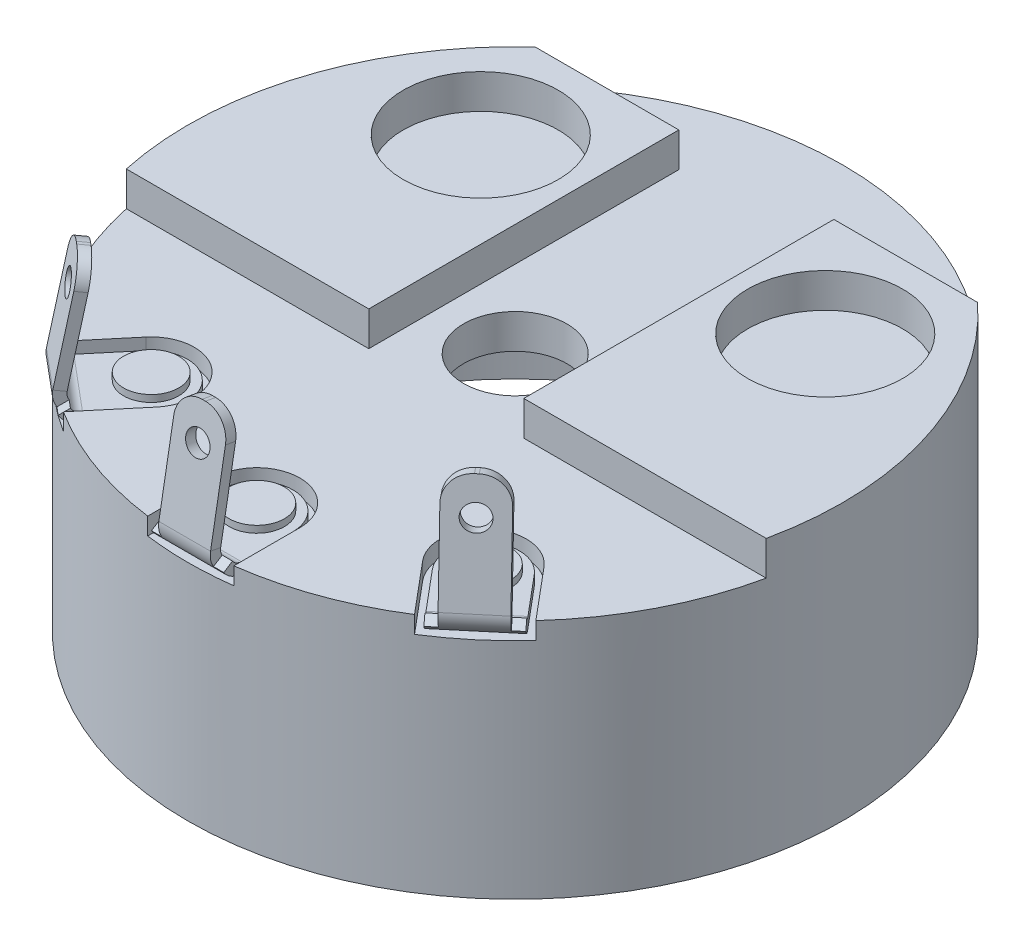
from build123d import *
from build123d.topology import SkipClean

# Parameters (mm, degrees)
SKETCH1_R                  = 4.75
SKETCH1_R_2                = 0.75
BOSS_EXTRUDE1_DEPTH        = 0.5
BOSS_EXTRUDE2_START        = 0.5
SKETCH1_3_R                = 1.125
BOSS_EXTRUDE2_DEPTH        = 0.5
SKETCH3_R                  = 0.375
CUT_EXTRUDE1_DEPTH         = 0.5
SKETCH3_3_R                = 0.375
CUT_EXTRUDE2_DEPTH         = 0.25
CIRPATTERN1_COUNT          = 3
CIRPATTERN1_ANGLE          = 80
EXTRUDE_THIN1_START        = -0.5
SKETCH1_4_R                = 4.75
SKETCH1_4_R_2              = 4.5
EXTRUDE_THIN1_DEPTH        = 3
BASE_FLANGE1_START         = 0.15
SKETCH4_R                  = 0.175
SKETCH4_R_2                = 0.375
BASE_FLANGE1_DEPTH         = 0.15
SKETCHED_START             = -0.525
SKETCHED_BEND1_DEPTH       = 1.05
SKETCHED_BEND1_2_DEPTH     = 1.05
SKETCHED_START_2           = -0.375
SKETCHED_BEND1_3_DEPTH     = 0.75
SKETCHED_START_3           = -4.741475404
SKETCHED_BEND1_4_OUTLINE_R = 0.175
SKETCHED_BEND1_4_DEPTH     = 0.149999999
SKETCH10_R                 = 0.375
BASE_FLANGE2_DEPTH         = 0.15
CIRPATTERN2_COUNT          = 3
CIRPATTERN2_ANGLE          = 80


with BuildPart() as part:
    # Sketch1 → Boss-Extrude1 (new body)
    with BuildSketch(Plane(origin=(0, 0, 0), x_dir=(1, 0, 0), z_dir=(0, 1, 0))):
        with Locations(Location((0, 0, 0), (0, 0, 270))):
            Circle(SKETCH1_R)
        with Locations(Location((0, 0, 0), (0, 0, 270))):
            Circle(SKETCH1_R_2, mode=Mode.SUBTRACT)
    extrude(amount=-BOSS_EXTRUDE1_DEPTH)

    # Sketch1<3> → Boss-Extrude2 (add)
    # profile 1 of 2: a face of its own
    with BuildSketch(Plane(origin=(0, 0, 0), x_dir=(1, 0, 0), z_dir=(0, 1, 0)).offset(BOSS_EXTRUDE2_START)):
        with BuildLine():
            ThreePointArc((-3.211308145, 3.5), (-4.526276083, 1.440598771), (-4.643543905, -1))
            Line((-4.643543905, -1), (-1.125, -1))
            Line((-1.125, -1), (-1.125, 3.5))
            Line((-1.125, 3.5), (-3.211308145, 3.5))
        make_face()
        with Locations(Location((-2.5, 2, 0), (0, 0, 270))):
            Circle(SKETCH1_3_R, mode=Mode.SUBTRACT)
    # profile 2 of 2: a face of its own
    with BuildSketch(Plane(origin=(0, 0, 0), x_dir=(1, 0, 0), z_dir=(0, 1, 0)).offset(BOSS_EXTRUDE2_START)):
        with BuildLine():
            Line((1.125, -1), (4.643543905, -1))
            ThreePointArc((4.643543905, -1), (4.723310997, -0.502825243), (4.75, 0))
            ThreePointArc((4.75, 0), (4.348345299, 1.911646713), (3.211308145, 3.5))
            Line((3.211308145, 3.5), (1.125, 3.5))
            Line((1.125, 3.5), (1.125, -1))
        make_face()
        with Locations(Location((2.5, 2, 0), (0, 0, 270))):
            Circle(SKETCH1_3_R, mode=Mode.SUBTRACT)
    extrude(amount=-BOSS_EXTRUDE2_DEPTH)

    # Sketch3 → Cut-Extrude1 (cut)
    with BuildSketch(Plane(origin=(0, 0, 0), x_dir=(1, 0, 0), z_dir=(0, 1, 0))):
        with Locations(Location((-2.410453536, -2.872666662, 0), (0, 0, 270))):
            Circle(SKETCH3_R)
    cut_extrude1 = extrude(amount=-CUT_EXTRUDE1_DEPTH, mode=Mode.SUBTRACT)

    # Sketch3<3> → Cut-Extrude2 (cut)
    with BuildSketch(Plane(origin=(0, 0, 0), x_dir=(1, 0, 0), z_dir=(0, 1, 0))):
        with BuildLine():
            Line((-3.505473113, -3.205332784), (-2.889231313, -2.470924406))
            ThreePointArc((-2.889231313, -2.470924406), (-2.00871128, -2.393888885), (-1.931675759, -3.274408918))
            Line((-1.931675759, -3.274408918), (-2.547917559, -4.008817296))
            ThreePointArc((-2.547917559, -4.008817296), (-3.053241146, -3.638711105), (-3.505473113, -3.205332784))
        make_face()
        with Locations(Location((-2.410453536, -2.872666662, 0), (0, 0, 270))):
            Circle(SKETCH3_3_R, mode=Mode.SUBTRACT)
    cut_extrude2 = extrude(amount=-CUT_EXTRUDE2_DEPTH, mode=Mode.SUBTRACT)

    # CirPattern1: Cut-Extrude1, Cut-Extrude2 ×3 about axis
    cirpattern1_axis = Axis((0, 0, 0), (0, 1, 0))
    add([cut_extrude1.rotate(cirpattern1_axis, i * CIRPATTERN1_ANGLE / (CIRPATTERN1_COUNT - 1)) for i in range(1, CIRPATTERN1_COUNT)], mode=Mode.SUBTRACT)
    add([cut_extrude2.rotate(cirpattern1_axis, i * CIRPATTERN1_ANGLE / (CIRPATTERN1_COUNT - 1)) for i in range(1, CIRPATTERN1_COUNT)], mode=Mode.SUBTRACT)

    # Sketch1<4> → Extrude-Thin1 (add)
    with BuildSketch(Plane(origin=(0, 0, 0), x_dir=(1, 0, 0), z_dir=(0, 1, 0)).offset(EXTRUDE_THIN1_START)):
        Circle(SKETCH1_4_R)
        Circle(SKETCH1_4_R_2, mode=Mode.SUBTRACT)
    extrude(amount=-EXTRUDE_THIN1_DEPTH)


with BuildPart() as body_2:
    # Base-Flange1: sheet metal written as solids
    # Sketch4 → Base-Flange1 (new body)
    with BuildSketch(Plane(origin=(0, -0.25, 0), x_dir=(1, 0, 0), z_dir=(0, 1, 0)).offset(BASE_FLANGE1_START)):
        with BuildLine():
            Line((-2.812626869, -2.535203167), (-3.428868668, -3.269611545))
            Line((-3.428868668, -3.269611545), (-3.313962002, -3.366029686))
            Line((-3.313962002, -3.366029686), (-4.213864655, -4.438491907))
            ThreePointArc((-4.213864655, -4.438491907), (-4.294417245, -4.69397208), (-4.170724764, -4.931583125))
            Line((-4.170724764, -4.931583125), (-4.132422542, -4.963722506))
            ThreePointArc((-4.132422542, -4.963722506), (-3.876942368, -5.044275095), (-3.639331323, -4.920582614))
            Line((-3.639331323, -4.920582614), (-2.73942867, -3.848120394))
            Line((-2.73942867, -3.848120394), (-2.624522003, -3.944538535))
            Line((-2.624522003, -3.944538535), (-2.008280204, -3.210130157))
            ThreePointArc((-2.008280204, -3.210130157), (-2.072990041, -2.470493329), (-2.812626869, -2.535203167))
        make_face()
        with Locations(Location((-3.830179848, -4.564630594, 0), (0, 0, 270))):
            Circle(SKETCH4_R, mode=Mode.SUBTRACT)
        with Locations(Location((-2.410453536, -2.872666662, 0), (0, 0, 270))):
            Circle(SKETCH4_R_2, mode=Mode.SUBTRACT)
    extrude(amount=-BASE_FLANGE1_DEPTH)

    # Sketched Bend1: read off the stored shape, not the designer's step
    # Sketched Bend1 outline → Sketched Bend1 (cut)
    with BuildSketch(Plane(origin=(0, 0, 0), x_dir=(0.6427876096865488, 0, -0.7660444431189701), z_dir=(0.76604444311897, 0, 0.642787609686549)).offset(SKETCHED_START)):
        with BuildLine():
            Line((-4.760983594, -0.1), (-6.45870205, -0.1))
            Line((-6.45870205, -0.1), (-6.45870205, -0.25))
            Line((-6.45870205, -0.25), (-4.501175973, -0.25))
            ThreePointArc((-4.501175973, -0.25), (-4.651175973, -0.209807621), (-4.760983594, -0.1))
        make_face()
    extrude(amount=SKETCHED_BEND1_DEPTH, mode=Mode.SUBTRACT)

    # Sketched Bend1 2 outline → Sketched Bend1 2 (add)
    with SkipClean():  # the faces are left unmerged after this step: merging them gives an invalid solid
        with BuildSketch(Plane(origin=(0, 0, 0), x_dir=(0.6427876096865488, 0, -0.7660444431189701), z_dir=(0.76604444311897, 0, 0.642787609686549)).offset(SKETCHED_START)):
            with BuildLine():
                ThreePointArc((-4.501175973, -0.1), (-4.57325702, -0.081545895), (-4.627602184, -0.030724302))
                Line((-4.627602184, -0.030724302), (-4.754028396, -0.111448605))
                ThreePointArc((-4.754028396, -0.111448605), (-4.73301345, -0.140397963), (-4.70870205, -0.166640087))
                Line((-4.70870205, -0.166640087), (-4.70870205, -0.1))
                Line((-4.70870205, -0.1), (-4.501175973, -0.1))
            make_face()
        extrude(amount=SKETCHED_BEND1_2_DEPTH)

    # Sketched Bend1 3 outline → Sketched Bend1 3 (add)
    with SkipClean():  # the faces are left unmerged after this step: merging them gives an invalid solid
        with BuildSketch(Plane(origin=(0, 0, 0), x_dir=(0.6427876096865488, 0, -0.7660444431189701), z_dir=(0.76604444311897, 0, 0.642787609686549)).offset(SKETCHED_START_2)):
            with BuildLine():
                ThreePointArc((-4.627602184, -0.030724302), (-4.648278779, 0.020661214), (-4.648897136, 0.076047227))
                Line((-4.648897136, 0.076047227), (-4.371712461, 1.648039633))
                Line((-4.371712461, 1.648039633), (-4.519433624, 1.674086859))
                Line((-4.519433624, 1.674086859), (-4.796618299, 0.102094453))
                ThreePointArc((-4.796618299, 0.102094453), (-4.796618299, -0.002094454), (-4.760983594, -0.1))
                Line((-4.760983594, -0.1), (-4.736098185, -0.1))
                Line((-4.736098185, -0.1), (-4.627602184, -0.030724302))
            make_face()
        extrude(amount=SKETCHED_BEND1_3_DEPTH)

    # Sketched Bend1 4 outline → Sketched Bend1 4 (cut)
    with SkipClean():  # the faces are left unmerged after this step: merging them gives an invalid solid
        with BuildSketch(Plane(origin=(0, 0, 0), x_dir=(0.7741336234862026, 0.1419950663058108, 0.6168910228986401), z_dir=(0.6330222215594979, -0.17364817766693397, -0.7544065067354808)).offset(SKETCHED_START_3)):
            with BuildLine():
                Line((-0.246525022, -0.908905109), (0.099817711, -0.858440159))
                ThreePointArc((0.099817711, -0.858440159), (-0.159864425, -0.792682829), (-0.296989971, -0.562562375))
                Line((-0.296989971, -0.562562375), (-0.246525022, -0.908905109))
            make_face()
            with BuildLine():
                ThreePointArc((0.445173029, -0.454423198), (0.379415699, -0.714105335), (0.149295245, -0.851230881))
                Line((0.149295245, -0.851230881), (0.495637978, -0.800765932))
                Line((0.495637978, -0.800765932), (0.445173029, -0.454423198))
            make_face()
            with Locations((0.052463694, -0.360060187)):
                Circle(SKETCHED_BEND1_4_OUTLINE_R)
        extrude(amount=SKETCHED_BEND1_4_DEPTH, mode=Mode.SUBTRACT)


with BuildPart() as body_3:
    # Base-Flange2: sheet metal written as solids
    # Sketch10 → Base-Flange2 (new body)
    with BuildSketch(Plane.XZ.offset(0.5)):
        with BuildLine():
            ThreePointArc((-2.828265483, 3.37059555), (0, -4.4), (2.828265483, 3.37059555))
            ThreePointArc((2.828265483, 3.37059555), (1.912524648, 3.290478608), (1.99264159, 2.374737774))
            ThreePointArc((1.99264159, 2.374737774), (0, -3.1), (-1.99264159, 2.374737774))
            ThreePointArc((-1.99264159, 2.374737774), (-1.912524648, 3.290478608), (-2.828265483, 3.37059555))
        make_face()
        with Locations(Location((2.410453536, 2.872666662, 0), (0, 0, 270))):
            Circle(SKETCH10_R, mode=Mode.SUBTRACT)
        with Locations(Location((-2.410453536, 2.872666662, 0), (0, 0, 270))):
            Circle(SKETCH10_R, mode=Mode.SUBTRACT)
    extrude(amount=BASE_FLANGE2_DEPTH)


with BuildPart() as body_4:
    # Sketch19 → Revolve1 (revolve)
    with BuildSketch(Plane(origin=(0, 0, 0), x_dir=(0.6427876096865404, 0, -0.7660444431189771), z_dir=(0.7660444431189771, 0, 0.6427876096865404)), mode=Mode.PRIVATE) as revolve1_sk:
        Polygon((-3.35, 0), (-3.75, 0), (-3.75, -0.75), (-3.35, -0.75), (-3.35, -0.65), (-3.375, -0.65), (-3.375, -0.1), (-3.35, -0.1), align=None)
    revolve(revolve1_sk.sketch.rotate(Axis((-2.410453536, -0.75, 2.872666662), (0, 1, 0)), 40), axis=Axis((-2.410453536, -0.75, 2.872666662), (0, 1, 0)))


with BuildPart() as cirpattern2_1:
    # CirPattern2: pattern copy
    add(body_2.part.rotate(Axis((0, 0, 0), (0, 1, 0)), 1 * CIRPATTERN2_ANGLE / (CIRPATTERN2_COUNT - 1)))


with BuildPart() as cirpattern2_2:
    # CirPattern2: pattern copy
    add(body_2.part.rotate(Axis((0, 0, 0), (0, 1, 0)), 2 * CIRPATTERN2_ANGLE / (CIRPATTERN2_COUNT - 1)))


with BuildPart() as cirpattern2_3:
    # CirPattern2: pattern copy
    add(body_4.part.rotate(Axis((0, 0, 0), (0, 1, 0)), 1 * CIRPATTERN2_ANGLE / (CIRPATTERN2_COUNT - 1)))


with BuildPart() as cirpattern2_4:
    # CirPattern2: pattern copy
    add(body_4.part.rotate(Axis((0, 0, 0), (0, 1, 0)), 2 * CIRPATTERN2_ANGLE / (CIRPATTERN2_COUNT - 1)))


solid = Compound([part.part, body_2.part, body_3.part, body_4.part, cirpattern2_1.part, cirpattern2_2.part, cirpattern2_3.part, cirpattern2_4.part])
